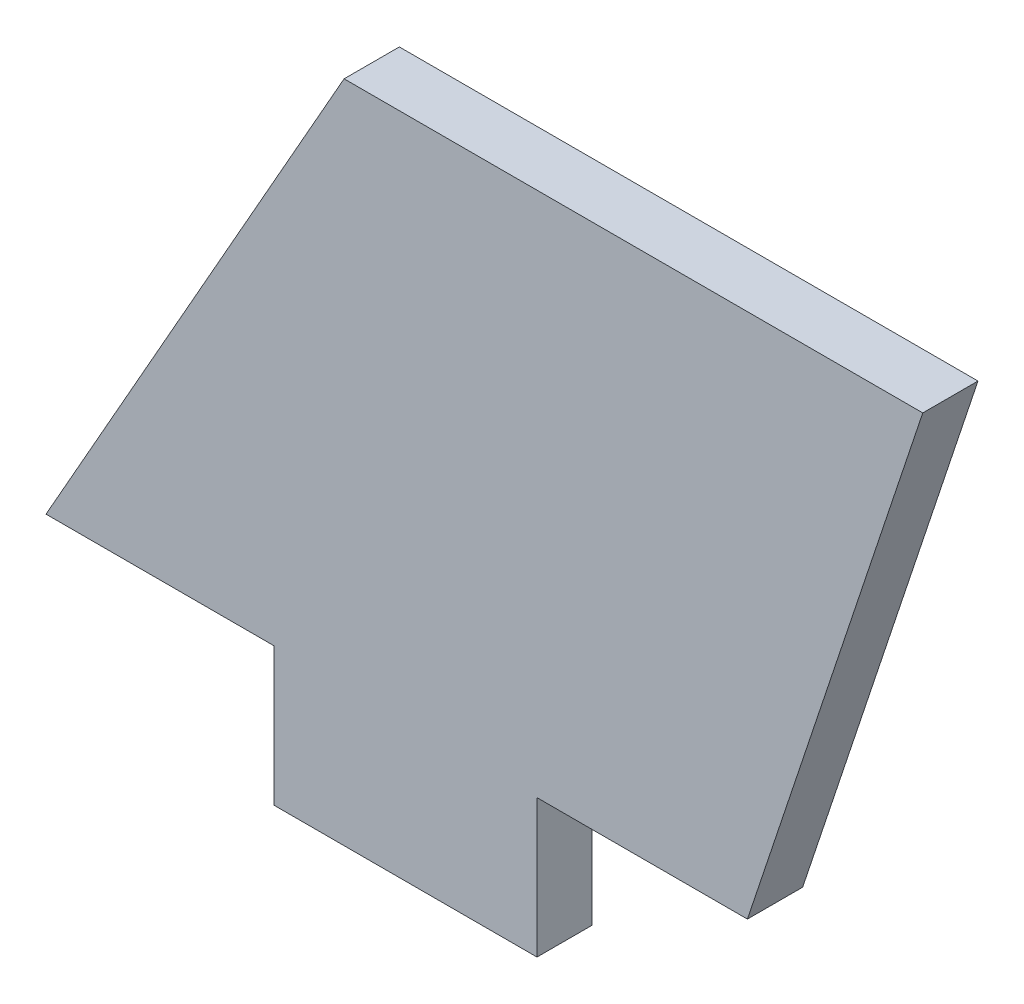
from build123d import *

# Parameters (mm, degrees)
BOSS_EXTRUDE1_DEPTH = 3.1496


with BuildPart() as part:
    # Sketch1 → Boss-Extrude1 (new body)
    with BuildSketch(Plane.XY):
        Polygon((0, 0), (13, 0), (13, -7.875), (28, -7.875), (28, 0), (40, 0), (50, 30), (17, 30), align=None)
    extrude(amount=BOSS_EXTRUDE1_DEPTH)


solid = part.part
